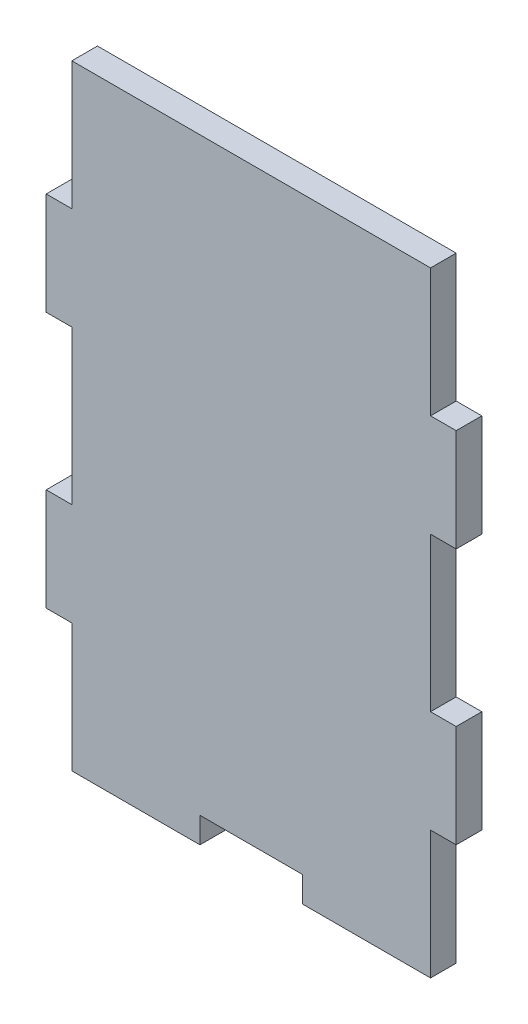
from build123d import *

# Parameters (mm, degrees)
BOSS_EXTRUDE1_DEPTH = 6.35


with BuildPart() as part:
    # Sketch1 → Boss-Extrude1 (new body)
    with BuildSketch(Plane.XY):
        Polygon((-20.155666918, 122.834231645), (-109.055666918, 122.834231645), (-109.055666918, 91.084231645), (-115.405666918, 91.084231645), (-115.405666918, 65.684231645), (-109.055666918, 65.684231645), (-109.055666918, 27.584231645), (-115.405666918, 27.584231645), (-115.405666918, 2.184231645), (-109.055666918, 2.184231645), (-109.055666918, -29.565768355), (-77.305666918, -29.565768355), (-77.305666918, -23.215768355), (-51.905666918, -23.215768355), (-51.905666918, -29.565768355), (-20.155666918, -29.565768355), (-20.155666918, 2.184231645), (-13.805666918, 2.184231645), (-13.805666918, 27.584231645), (-20.155666918, 27.584231645), (-20.155666918, 65.684231645), (-13.805666918, 65.684231645), (-13.805666918, 91.084231645), (-20.155666918, 91.084231645), align=None)
    extrude(amount=BOSS_EXTRUDE1_DEPTH)


solid = part.part
